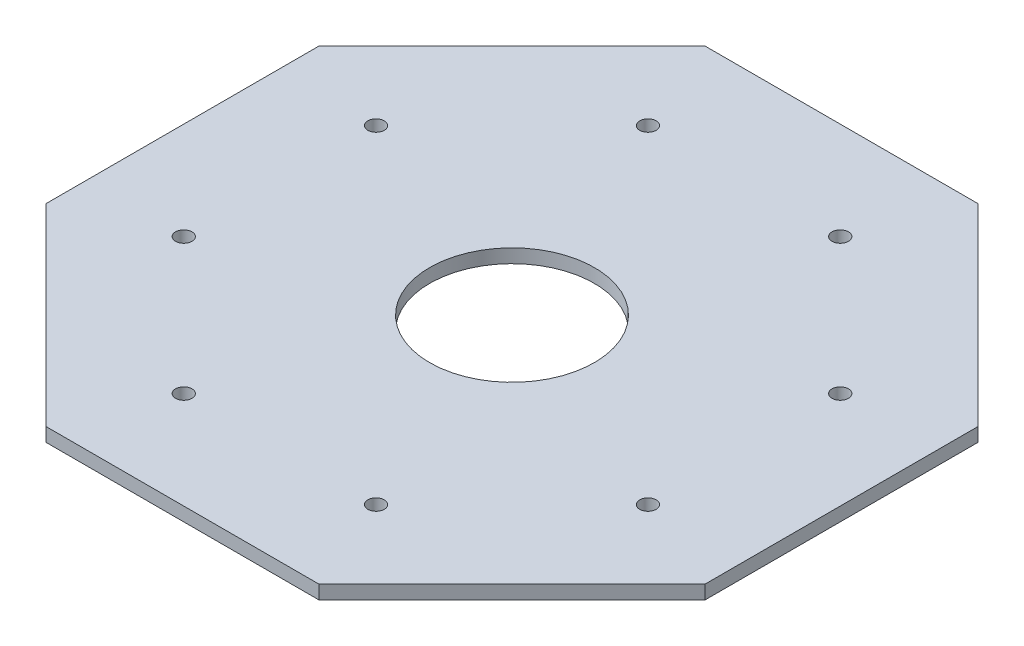
from build123d import *

# Parameters (mm, degrees)
BOSS_EXTRUDE1_DEPTH     = 6.35
CUT_EXTRUDE1_DEPTH      = 216.619670949
CUT_EXTRUDE1_DEPTH_BACK = 216.619670949
SKETCH2_R               = 38.1
SKETCH3_R               = 3.81
CUT_EXTRUDE2_DEPTH      = 216.619670949


with BuildPart() as part:
    # Sketch1 → Boss-Extrude1 (new body)
    with BuildSketch(Plane(origin=(0, 0, 0), x_dir=(1, 0, 0), z_dir=(0, 1, 0))):
        Polygon((63.126146906, 152.4), (-63.126146906, 152.4), (-152.4, 63.126146906), (-152.4, -63.126146906), (-63.126146906, -152.4), (63.126146906, -152.4), (152.4, -63.126146906), (152.4, 63.126146906), align=None)
    extrude(amount=BOSS_EXTRUDE1_DEPTH)

    # Sketch2 → Cut-Extrude1 (cut, two sides: drawn at the far end of the back side and taken through both)
    with BuildSketch(Plane(origin=(0, 6.35, 0), x_dir=(1, 0, 0), z_dir=(0, 1, 0)).offset(-CUT_EXTRUDE1_DEPTH_BACK)):
        Circle(SKETCH2_R)
    extrude(amount=CUT_EXTRUDE1_DEPTH + CUT_EXTRUDE1_DEPTH_BACK, mode=Mode.SUBTRACT)

    # Sketch3 → Cut-Extrude2 (cut, through all)
    with BuildSketch(Plane(origin=(0, 6.35, 0), x_dir=(1, 0, 0), z_dir=(0, 1, 0))):
        with Locations((44.463441276, -107.344242958)):
            Circle(SKETCH3_R)
        with Locations((-44.463441276, -107.344242958)):
            Circle(SKETCH3_R)
        with Locations((-107.344242958, -44.463441276)):
            Circle(SKETCH3_R)
        with Locations((-107.344242958, 44.463441276)):
            Circle(SKETCH3_R)
        with Locations((-44.463441276, 107.344242958)):
            Circle(SKETCH3_R)
        with Locations((44.463441276, 107.344242958)):
            Circle(SKETCH3_R)
        with Locations((107.344242958, 44.463441276)):
            Circle(SKETCH3_R)
        with Locations((107.344242958, -44.463441276)):
            Circle(SKETCH3_R)
    extrude(amount=-CUT_EXTRUDE2_DEPTH, mode=Mode.SUBTRACT)


solid = part.part
